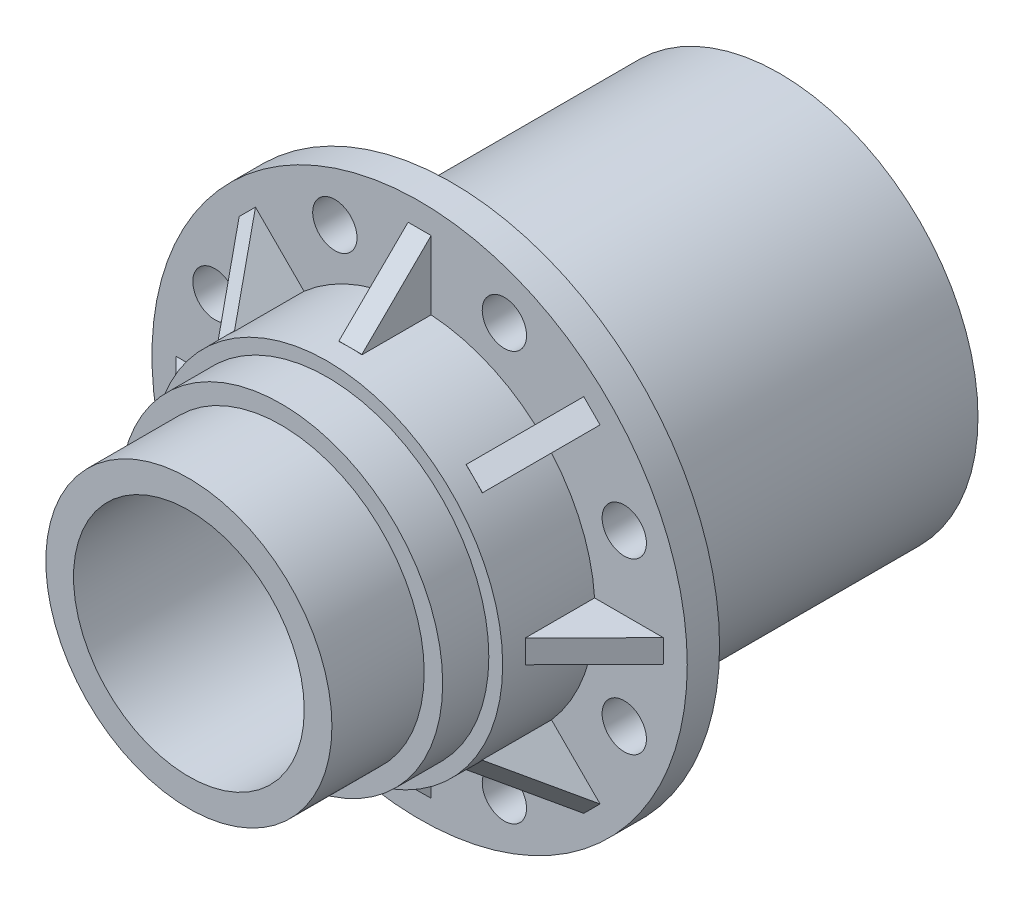
from build123d import *

# Parameters (mm, degrees)
SKETCH2_R            = 215
SKETCH2_R_2          = 155
BOSS_EXTRUDE1_DEPTH  = 390
SKETCH2_3_R          = 155
SKETCH2_3_R_2        = 125
BOSS_EXTRUDE2_DEPTH  = 315
SKETCH2_5_R          = 125
SKETCH2_5_R_2        = 80
BOSS_EXTRUDE4_DEPTH  = 190
SKETCH2_6_R          = 125
SKETCH2_6_R_2        = 80
CUT_EXTRUDE1_DEPTH   = 165
SKETCH2_7_R          = 125
SKETCH2_7_R_2        = 105
BOSS_EXTRUDE5_DEPTH  = 165
CUT_EXTRUDE2_START   = -165
SKETCH2_9_R          = 105
SKETCH2_9_R_2        = 80
CUT_EXTRUDE2_DEPTH   = 165
CUT_EXTRUDE2_DRAFT   = -8.7461623
SKETCH2_10_R         = 155
SKETCH2_10_R_2       = 125
BOSS_EXTRUDE6_DEPTH  = 165
SKETCH2_12_R         = 215
SKETCH2_12_R_2       = 190
CUT_EXTRUDE3_DEPTH   = 60
SKETCH2_13_R         = 290
SKETCH2_13_R_2       = 80
BOSS_EXTRUDE7_DEPTH  = 35
BOSS_EXTRUDE8_START  = 100
SKETCH3_R            = 190
SKETCH3_R_2          = 125
BOSS_EXTRUDE8_DEPTH  = 100
BOSS_EXTRUDE10_START = 150
SKETCH3_5_R          = 175
SKETCH3_5_R_2        = 125
BOSS_EXTRUDE10_DEPTH = 150
BOSS_EXTRUDE11_START = 250
SKETCH3_6_R          = 155
SKETCH3_6_R_2        = 125
BOSS_EXTRUDE11_DEPTH = 250
CUT_EXTRUDE5_REACH   = 567.951
SKETCH4_R            = 24
CIRPATTERN2_COUNT    = 8
BOSS_EXTRUDE12_DEPTH = 12.5
CIRPATTERN3_COUNT    = 8


with BuildPart() as part:
    # Sketch2 → Boss-Extrude1 (new body)
    with BuildSketch(Plane(origin=(0, 0, 0), x_dir=(0, 1, 0), z_dir=(0, 0, 1))):
        Circle(SKETCH2_R)
        Circle(SKETCH2_R_2, mode=Mode.SUBTRACT)
    extrude(amount=-BOSS_EXTRUDE1_DEPTH)

    # Sketch2<3> → Boss-Extrude2 (add)
    with BuildSketch(Plane(origin=(0, 0, 0), x_dir=(0, 1, 0), z_dir=(0, 0, 1))):
        Circle(SKETCH2_3_R)
        Circle(SKETCH2_3_R_2, mode=Mode.SUBTRACT)
    extrude(amount=-BOSS_EXTRUDE2_DEPTH)

    # Sketch2<5> → Boss-Extrude4 (add)
    with BuildSketch(Plane(origin=(0, 0, 0), x_dir=(0, 1, 0), z_dir=(0, 0, 1))):
        Circle(SKETCH2_5_R)
        Circle(SKETCH2_5_R_2, mode=Mode.SUBTRACT)
    extrude(amount=-BOSS_EXTRUDE4_DEPTH)

    # Sketch2<6> → Cut-Extrude1 (cut)
    with BuildSketch(Plane(origin=(0, 0, 0), x_dir=(0, 1, 0), z_dir=(0, 0, 1))):
        Circle(SKETCH2_6_R)
        Circle(SKETCH2_6_R_2, mode=Mode.SUBTRACT)
    extrude(amount=-CUT_EXTRUDE1_DEPTH, mode=Mode.SUBTRACT)

    # Sketch2<7> → Boss-Extrude5 (add)
    with BuildSketch(Plane(origin=(0, 0, 0), x_dir=(0, 1, 0), z_dir=(0, 0, 1))):
        Circle(SKETCH2_7_R)
        Circle(SKETCH2_7_R_2, mode=Mode.SUBTRACT)
    extrude(amount=-BOSS_EXTRUDE5_DEPTH)


with BuildPart() as cut_extrude2_tool:
    # Sketch2<9> → Cut-Extrude2 (with draft: the straight prism first)
    with BuildSketch(Plane(origin=(0, 0, 0), x_dir=(0, 1, 0), z_dir=(0, 0, 1)).offset(CUT_EXTRUDE2_START)):
        Circle(SKETCH2_9_R)
        Circle(SKETCH2_9_R_2, mode=Mode.SUBTRACT)
    extrude(amount=CUT_EXTRUDE2_DEPTH)
    # Cut-Extrude2: the draft: its side faces are tilted about the plane it starts from
    cut_extrude2_sides = [cut_extrude2_tool.faces().sort_by_distance(p)[0] for p in [
        (0, -105, -82.5),
        (0, -80, -82.5),
    ]]
    draft(cut_extrude2_sides, Plane(origin=(0, 0, 0), x_dir=(0, 1, 0), z_dir=(0, 0, 1)).offset(CUT_EXTRUDE2_START), CUT_EXTRUDE2_DRAFT)


with BuildPart() as part_1:
    add(part.part)

    # Cut-Extrude2: cut by cut_extrude2_tool
    add(cut_extrude2_tool.part, mode=Mode.SUBTRACT)

    # Sketch2<10> → Boss-Extrude6 (add)
    with BuildSketch(Plane(origin=(0, 0, 0), x_dir=(0, 1, 0), z_dir=(0, 0, 1))):
        Circle(SKETCH2_10_R)
        Circle(SKETCH2_10_R_2, mode=Mode.SUBTRACT)
    extrude(amount=-BOSS_EXTRUDE6_DEPTH)

    # Sketch2<12> → Cut-Extrude3 (cut)
    with BuildSketch(Plane(origin=(0, 0, 0), x_dir=(0, 1, 0), z_dir=(0, 0, 1))):
        Circle(SKETCH2_12_R)
        Circle(SKETCH2_12_R_2, mode=Mode.SUBTRACT)
    extrude(amount=-CUT_EXTRUDE3_DEPTH, mode=Mode.SUBTRACT)


with BuildPart() as boss_extrude7_tool:
    # Sketch2<13> → Boss-Extrude7 (new body)
    with BuildSketch(Plane(origin=(0, 0, 0), x_dir=(0, 1, 0), z_dir=(0, 0, 1))):
        Circle(SKETCH2_13_R)
        Circle(SKETCH2_13_R_2, mode=Mode.SUBTRACT)
    extrude(amount=-BOSS_EXTRUDE7_DEPTH)


with BuildPart() as part_2:
    add(part_1.part)


with BuildPart() as part_3:
    # Boss-Extrude7: joined with boss_extrude7_tool
    add(part_2.part.fuse(boss_extrude7_tool.part, tol=0.00001))

    # Sketch3 → Boss-Extrude8 (add)
    with BuildSketch(Plane.XY.offset(BOSS_EXTRUDE8_START)):
        Circle(SKETCH3_R)
        Circle(SKETCH3_R_2, mode=Mode.SUBTRACT)
    extrude(amount=-BOSS_EXTRUDE8_DEPTH)

    # Sketch3<5> → Boss-Extrude10 (add)
    with BuildSketch(Plane.XY.offset(BOSS_EXTRUDE10_START)):
        Circle(SKETCH3_5_R)
        Circle(SKETCH3_5_R_2, mode=Mode.SUBTRACT)
    extrude(amount=-BOSS_EXTRUDE10_DEPTH)

    # Sketch3<6> → Boss-Extrude11 (add)
    with BuildSketch(Plane.XY.offset(BOSS_EXTRUDE11_START)):
        Circle(SKETCH3_6_R)
        Circle(SKETCH3_6_R_2, mode=Mode.SUBTRACT)
    extrude(amount=-BOSS_EXTRUDE11_DEPTH)

    # Sketch4 → Cut-Extrude5 (cut, up to next)
    with BuildSketch(Plane.XY, mode=Mode.PRIVATE) as cut_extrude5_sk1:
        with Locations((221.731087803, 91.844023768)):
            Circle(SKETCH4_R)
    cut_extrude5_tool1 = extrude(cut_extrude5_sk1.sketch, amount=-CUT_EXTRUDE5_REACH, mode=Mode.PRIVATE) & part_3.part
    cut_extrude5 = cut_extrude5_tool1.solids().sort_by_distance((221.731088, 91.844024, 0))[0]
    add(cut_extrude5, mode=Mode.SUBTRACT)

    # CirPattern2: Cut-Extrude5 ×8 about axis
    cirpattern2_axis = Axis((0, 0, 0), (0, 0, 1))
    for i in range(1, CIRPATTERN2_COUNT):
        add(cut_extrude5.rotate(cirpattern2_axis, i * 360 / CIRPATTERN2_COUNT), mode=Mode.SUBTRACT)

    # Sketch6 → Boss-Extrude12 (add, symmetric)
    with BuildSketch(Plane.YZ):
        Polygon((-264, 0), (-168, 0), (-168, 75), (-190, 75), align=None)
    boss_extrude12 = extrude(amount=BOSS_EXTRUDE12_DEPTH, both=True)

    # CirPattern3: Boss-Extrude12 ×8 about axis
    cirpattern3_axis = Axis((0, 0, 0), (0, 0, 1))
    for i in range(1, CIRPATTERN3_COUNT):
        add(boss_extrude12.rotate(cirpattern3_axis, i * 360 / CIRPATTERN3_COUNT))


solid = part_3.part
